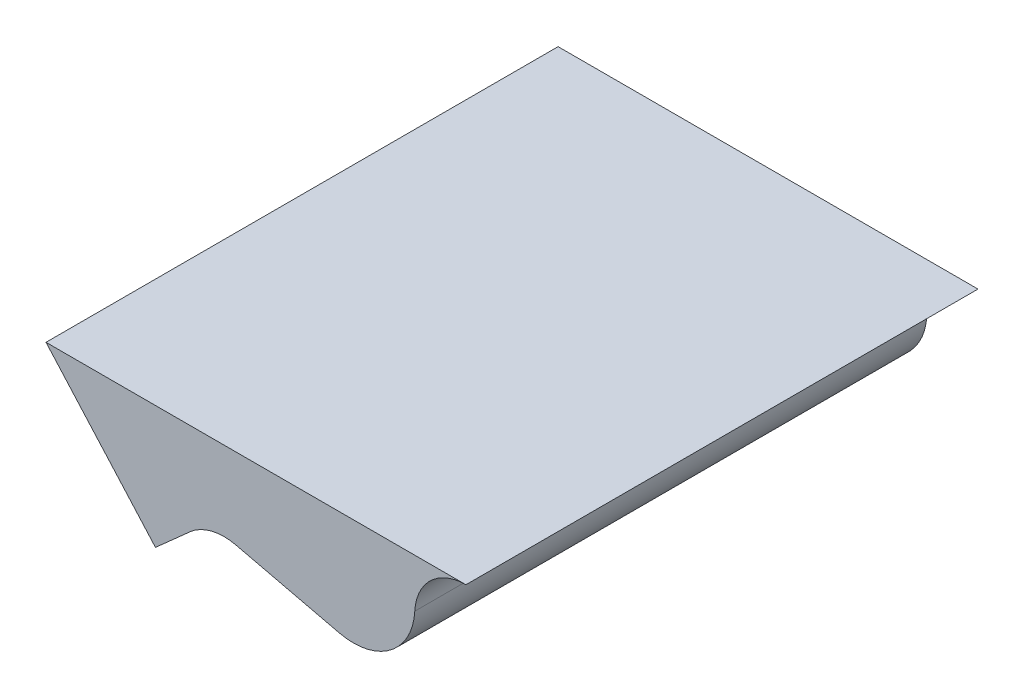
from build123d import *

# Parameters (mm, degrees)
SKETCH1_W          = 50
SKETCH1_H          = 5
BASE_EXTRUDE_DEPTH = 25
LANCE_TOOL_DEPTH   = 12.5
INSIDE_FILLET_R    = 2.5
ROUND_2_R          = 3
SKETCH3_W          = 50
SKETCH3_H          = 5
CLEANUP_CUT_DEPTH  = 57.222771198


with BuildPart() as part:
    # Sketch1 → Base-Extrude (new, symmetric)
    with BuildSketch(Plane.XY):
        with Locations((0, 2.5)):
            Rectangle(SKETCH1_W, SKETCH1_H)
    extrude(amount=BASE_EXTRUDE_DEPTH, both=True)

    # Lance Tool sketch → Lance Tool (add, symmetric)
    with BuildSketch(Plane.XY):
        Polygon((9, 0), (-9, 0), (-3.655887015, -6), (-1, -3.634439953), (9, -6), align=None)
    extrude(amount=LANCE_TOOL_DEPTH, both=True)

    # Inside Fillet
    inside_fillet_edges = [part.edges().sort_by_distance(p)[0] for p in [
        (9, 0, 0),
        (-1, -3.634439953, 0),
    ]]
    fillet(inside_fillet_edges, radius=INSIDE_FILLET_R)

    # Round 2
    round_2_edges = [part.edges().sort_by_distance(p)[0] for p in [
        (9, -6, 0),
    ]]
    fillet(round_2_edges, radius=ROUND_2_R)

    # Sketch3 → Cleanup Cut (cut, through all)
    with BuildSketch(Plane(origin=(25, 0, 0), x_dir=(0, 0, -1), z_dir=(1, 0, 0))):
        with Locations((0, 2.5)):
            Rectangle(SKETCH3_W, SKETCH3_H)
    extrude(amount=-CLEANUP_CUT_DEPTH, mode=Mode.SUBTRACT)


solid = part.part
